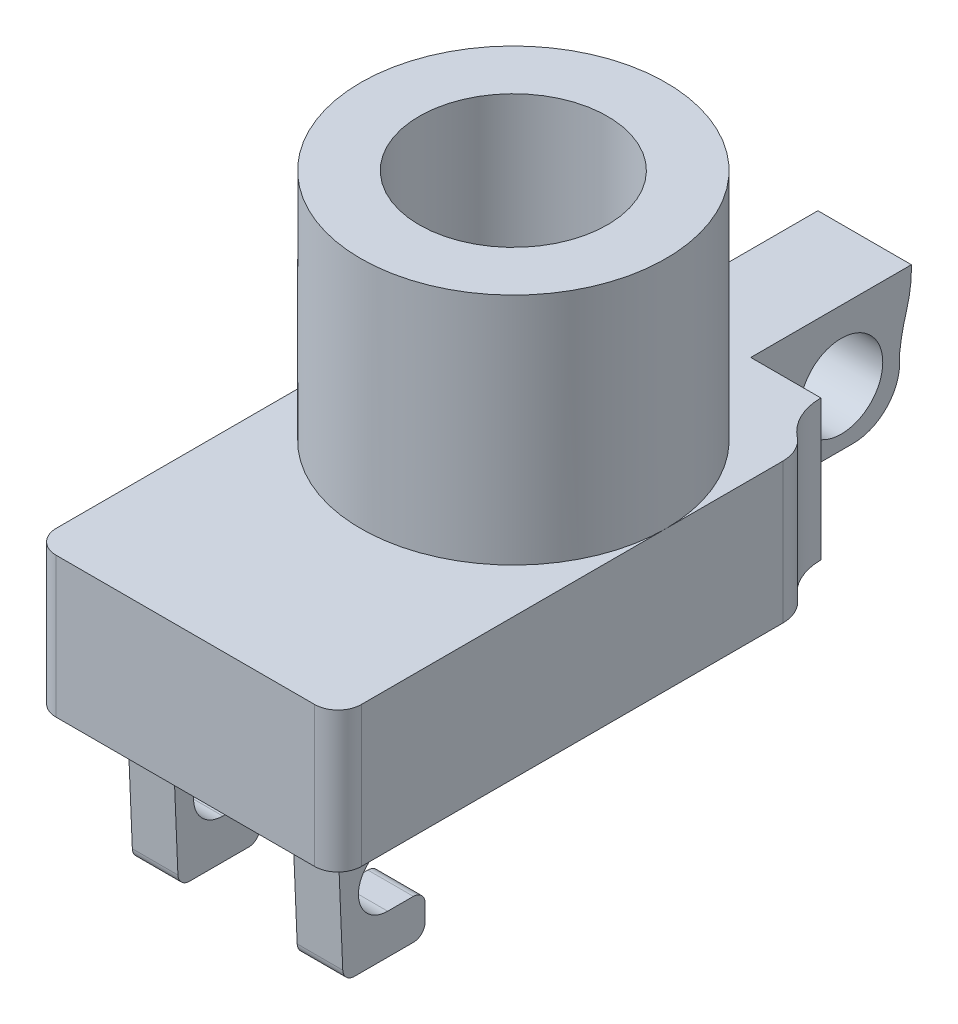
from build123d import *
from OCP.BRepFilletAPI import BRepFilletAPI_MakeChamfer

# Parameters (mm, degrees)
BOSS_EXTRUDE1_DEPTH     = 12
SKETCH2_W               = 8
SKETCH2_H               = 12
BOSS_EXTRUDE2_DEPTH     = 14.74
CUT_EXTRUDE1_DEPTH      = 37.164969238
CUT_EXTRUDE1_DEPTH_BACK = 37.164969238
SKETCH3_W               = 14.74
SKETCH3_H               = 1.25
CUT_EXTRUDE2_DEPTH      = 37.164969238
CUT_EXTRUDE2_DEPTH_BACK = 37.164969238
SKETCH4_R               = 3.55
CUT_EXTRUDE3_DEPTH      = 37.164969238
CUT_EXTRUDE3_DEPTH_BACK = 37.164969238
SKETCH6_W               = 2
SKETCH6_H               = 10.75
FILLET1_R               = 4
BOSS_EXTRUDE3_DEPTH     = 8
SKETCH8_R               = 13.05
SKETCH8_R_2             = 8.05
BOSS_EXTRUDE4_DEPTH     = 20
SKETCH9_W               = 3.9
SKETCH9_H               = 7.5
BOSS_EXTRUDE5_DEPTH     = 11.9
CUT_EXTRUDE4_DEPTH      = 49.820129045
CUT_EXTRUDE4_DEPTH_BACK = 49.820129045
CHAMFER1_SIZE           = 11.9
CHAMFER1_SIZE_2         = 0.5
FILLET3_R               = 1


with BuildPart() as part:
    # Sketch1 → Boss-Extrude1 (new body)
    with BuildSketch(Plane(origin=(0, 0, 0), x_dir=(1, 0, 0), z_dir=(0, 1, 0))):
        with BuildLine():
            Line((-13.05, 8.5), (-13.05, -27.55))
            ThreePointArc((-13.05, -27.55), (-12.464213562, -28.964213562), (-11.05, -29.55))
            Line((-11.05, -29.55), (11.05, -29.55))
            ThreePointArc((11.05, -29.55), (12.464213562, -28.964213562), (13.05, -27.55))
            Line((13.05, -27.55), (13.05, 8.5))
            ThreePointArc((13.05, 8.5), (12.745947042, 9.827507004), (11.894409938, 10.890337003))
            ThreePointArc((11.894409938, 10.890337003), (10.498447473, 12.632681264), (10, 14.808922253))
            Line((10, 14.808922253), (-10, 14.808922253))
            ThreePointArc((-10, 14.808922253), (-10.498447473, 12.632681264), (-11.894409938, 10.890337003))
            ThreePointArc((-11.894409938, 10.890337003), (-12.745947042, 9.827507004), (-13.05, 8.5))
        make_face()
    extrude(amount=BOSS_EXTRUDE1_DEPTH)

    # Sketch2 → Boss-Extrude2 (add)
    with BuildSketch(Plane(origin=(0, 0, -14.808922253), x_dir=(-1, 0, 0), z_dir=(0, 0, -1))):
        with Locations((0, 6)):
            Rectangle(SKETCH2_W, SKETCH2_H)
    extrude(amount=BOSS_EXTRUDE2_DEPTH)

    # Sketch3 → Cut-Extrude1 (cut, two sides: drawn at the far end of the back side and taken through both)
    with BuildSketch(Plane(origin=(4, 0, 0), x_dir=(0, 0, -1), z_dir=(1, 0, 0)).offset(-CUT_EXTRUDE1_DEPTH_BACK)):
        with Locations((22.178922253, 0.625)):
            Rectangle(SKETCH3_W, SKETCH3_H)
    extrude(amount=CUT_EXTRUDE1_DEPTH + CUT_EXTRUDE1_DEPTH_BACK, mode=Mode.SUBTRACT)

    # Sketch4 → Cut-Extrude2 (cut, two sides: drawn at the far end of the back side and taken through both)
    with BuildSketch(Plane(origin=(4, 0, 0), x_dir=(0, 0, -1), z_dir=(1, 0, 0)).offset(-CUT_EXTRUDE2_DEPTH_BACK)):
        with Locations((22.548922253, 6)):
            Circle(SKETCH4_R)
    extrude(amount=CUT_EXTRUDE2_DEPTH + CUT_EXTRUDE2_DEPTH_BACK, mode=Mode.SUBTRACT)

    # Sketch6 → Cut-Extrude3 (cut, two sides: drawn at the far end of the back side and taken through both)
    with BuildSketch(Plane(origin=(4, 0, 0), x_dir=(0, 0, -1), z_dir=(1, 0, 0)).offset(-CUT_EXTRUDE3_DEPTH_BACK)):
        with Locations((28.548922253, 6.625)):
            Rectangle(SKETCH6_W, SKETCH6_H)
    extrude(amount=CUT_EXTRUDE3_DEPTH + CUT_EXTRUDE3_DEPTH_BACK, mode=Mode.SUBTRACT)

    # Fillet1
    fillet1_edges = [part.edges().sort_by_distance(p)[0] for p in [
        (0, 1.25, -27.548922253),
    ]]
    fillet(fillet1_edges, radius=FILLET1_R)

    # Sketch7 → Boss-Extrude3 (add)
    with BuildSketch(Plane(origin=(4, 0, 0), x_dir=(0, 0, -1), z_dir=(1, 0, 0))):
        with BuildLine():
            Line((27.548922253, 10), (27.548922253, 6))
            ThreePointArc((27.548922253, 6), (27.773781475, 7.398207316), (28.122230045, 8.770843088))
            ThreePointArc((28.122230045, 8.770843088), (28.441674093, 10.200150162), (28.548922253, 11.660787366))
            Line((28.548922253, 11.660787366), (28.548922253, 12))
            Line((28.548922253, 12), (27.548922253, 12))
            Line((27.548922253, 12), (27.548922253, 10))
        make_face()
    extrude(amount=-BOSS_EXTRUDE3_DEPTH)

    # Sketch8 → Boss-Extrude4 (add)
    with BuildSketch(Plane(origin=(0, 12, 0), x_dir=(1, 0, 0), z_dir=(0, 1, 0))):
        with Locations(Location((0, -1.5, 0), (0, 0, 180))):
            Circle(SKETCH8_R)
        with Locations(Location((0, -1.5, 0), (0, 0, 270))):
            Circle(SKETCH8_R_2, mode=Mode.SUBTRACT)
    extrude(amount=BOSS_EXTRUDE4_DEPTH)

    # Sketch9 → Boss-Extrude5 (add)
    with BuildSketch(Plane.XZ):
        with Locations((-7.05, 21.8)):
            Rectangle(SKETCH9_W, SKETCH9_H)
        with Locations((7.05, 21.8)):
            Rectangle(SKETCH9_W, SKETCH9_H)
    extrude(amount=BOSS_EXTRUDE5_DEPTH)

    # Sketch10 → Cut-Extrude4 (cut, two sides: drawn at the far end of the back side and taken through both)
    with BuildSketch(Plane.ZY.offset(9).offset(-CUT_EXTRUDE4_DEPTH_BACK)):
        with BuildLine():
            Line((21.25, -3.49), (13.718722393, -3.49))
            Line((13.718722393, -3.49), (13.718722393, -8.49))
            Line((13.718722393, -8.49), (21.25, -8.49))
            ThreePointArc((21.25, -8.49), (23.75, -5.99), (21.25, -3.49))
        make_face()
    extrude(amount=CUT_EXTRUDE4_DEPTH + CUT_EXTRUDE4_DEPTH_BACK, mode=Mode.SUBTRACT)

    # Chamfer1
    chamfer1_edges_1 = [part.edges().sort_by_distance(p)[0] for p in [
        (-7.05, -11.9, 25.55),
    ]]
    chamfer1_side_1 = [part.faces().sort_by_distance(p)[0] for p in [
        (-7.05, -11.89, 25.55),
    ]]
    chamfer1_edges_2 = [part.edges().sort_by_distance(p)[0] for p in [
        (7.05, -11.9, 25.55),
    ]]
    chamfer1_side_2 = [part.faces().sort_by_distance(p)[0] for p in [
        (7.05, -11.89, 25.55),
    ]]
    chamfer1 = BRepFilletAPI_MakeChamfer(part.part.solid().wrapped)
    for e in chamfer1_edges_1:
        chamfer1.Add(CHAMFER1_SIZE - 0.0001, CHAMFER1_SIZE_2 - 0.0001, e.wrapped, chamfer1_side_1[0].wrapped)
    for e in chamfer1_edges_2:
        chamfer1.Add(CHAMFER1_SIZE - 0.0001, CHAMFER1_SIZE_2 - 0.0001, e.wrapped, chamfer1_side_2[0].wrapped)
    add(Compound.cast(chamfer1.Shape()), mode=Mode.REPLACE)  # a hair under: the kernel refuses the full size

    # Fillet3
    fillet3_edges = [part.edges().sort_by_distance(p)[0] for p in [
        (-7.05, -11.9, 18.05),
        (7.05, -11.9, 18.05),
        (7.05, -8.49, 18.05),
        (-7.05, -8.49, 18.05),
        (7.05, -3.49, 18.05),
        (-7.05, -3.49, 18.05),
        (-7.05, -11.9, 25.0501),
        (7.05, -11.9, 25.0501),
    ]]
    fillet(fillet3_edges, radius=FILLET3_R)


solid = part.part
